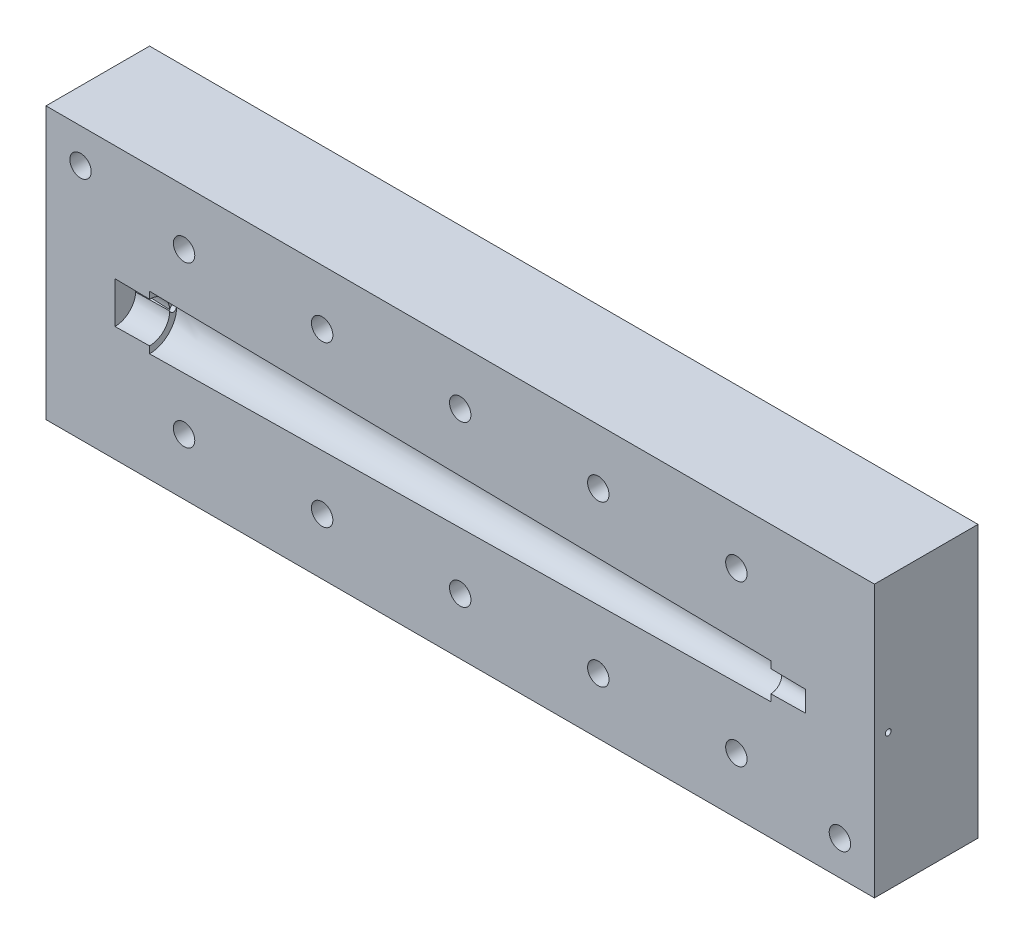
from build123d import *

# Parameters (mm, degrees)
SKIZZE2_W                        = 120
SKIZZE2_H                        = 39.364160046
AUFSATZ_LINEAR_AUSTRAGEN1_DEPTH  = 30
SKIZZE24_R                       = 1.55
SCHNITT_LINEAR_AUSTRAGEN4_DEPTH  = 130.805766806
SKIZZE46_R                       = 2.85
SCHNITT_LINEAR_AUSTRAGEN15_DEPTH = 10
SCHNITT_LINEAR_START             = -5
SCHNITT_LINEAR_AUSTRAGEN25_DEPTH = 2.7
LINEARES_MUSTER1_COUNT           = 5
LINEARES_MUSTER1_PITCH           = 20
SPIEGELN2_COPY_1_SKETCH_R        = 2.85
SPIEGELN2_COPY_1_DEPTH           = 10
SPIEGELN2_COPY_2_SKETCH_R        = 2.85
SPIEGELN2_COPY_2_DEPTH           = 10
SPIEGELN2_COPY_3_SKETCH_R        = 2.85
SPIEGELN2_COPY_3_DEPTH           = 10
SPIEGELN2_COPY_4_SKETCH_R        = 2.85
SPIEGELN2_COPY_4_DEPTH           = 10
SPIEGELN2_START                  = -5
SPIEGELN2_COPY_5_DEPTH           = 2.7
SPIEGELN2_COPY_6_DEPTH           = 2.7
SPIEGELN2_COPY_7_DEPTH           = 2.7
SPIEGELN2_COPY_8_DEPTH           = 2.7
SKIZZE51_R                       = 1.55
SCHNITT_LINEAR_AUSTRAGEN26_DEPTH = 130.805766806
SKIZZE67_R                       = 0.425
SCHNITT_LINEAR_AUSTRAGEN30_DEPTH = 20
SKIZZE70_R                       = 0.5
SCHNITT_LINEAR_AUSTRAGEN37_DEPTH = 16
SKIZZE71_R                       = 2
SCHNITT_LINEAR_AUSTRAGEN38_DEPTH = 6
ABSPALTEN3_START                 = 15
ABSPALTEN3_OUTLINE_W             = 120
ABSPALTEN3_OUTLINE_H             = 39.364160046
ABSPALTEN3_OUTLINE_R             = 1.55
ABSPALTEN3_DEPTH                 = 15


# Read off the part's stored shape, not the designer's step: Abspalten3
with BuildPart() as part:
    # Skizze2 → Aufsatz-Linear austragen1 (new body)
    with BuildSketch(Plane.XY):
        with Locations((60, 19.682080023)):
            Rectangle(SKIZZE2_W, SKIZZE2_H)
    extrude(amount=AUFSATZ_LINEAR_AUSTRAGEN1_DEPTH)

    # Skizze24 → Schnitt-Linear austragen4 (cut, through all)
    with BuildSketch(Plane.XY.offset(30)):
        with Locations((20, 31.364160046)):
            Circle(SKIZZE24_R)
        with Locations((40, 31.364160046)):
            Circle(SKIZZE24_R)
        with Locations((60, 31.364160046)):
            Circle(SKIZZE24_R)
        with Locations((80, 31.364160046)):
            Circle(SKIZZE24_R)
        with Locations((100, 31.364160046)):
            Circle(SKIZZE24_R)
    schnitt_linear_austragen4 = extrude(amount=-SCHNITT_LINEAR_AUSTRAGEN4_DEPTH, mode=Mode.SUBTRACT)

    # Skizze46 → Schnitt-Linear austragen15 (cut)
    with BuildSketch(Plane(origin=(0, 0, 0), x_dir=(-1, 0, 0), z_dir=(0, 0, -1))):
        with Locations((-100, 31.364160046)):
            Circle(SKIZZE46_R)
    schnitt_linear_austragen15 = extrude(amount=-SCHNITT_LINEAR_AUSTRAGEN15_DEPTH, mode=Mode.SUBTRACT)

    # Skizze50 → Schnitt-Linear austragen25 (cut)
    with BuildSketch(Plane.XY.offset(30).offset(SCHNITT_LINEAR_START)):
        Polygon((97.15, 33.009608314), (97.15, 39.364160046), (102.85, 39.364160046), (102.85, 33.009608314), (102.85, 29.718711779), (100, 28.073263512), (97.15, 29.718711779), align=None)
    schnitt_linear_austragen25 = extrude(amount=-SCHNITT_LINEAR_AUSTRAGEN25_DEPTH, mode=Mode.SUBTRACT)

    # Lineares Muster1: Schnitt-Linear austragen15, Schnitt-Linear austragen25 ×5
    with Locations(*[(-i * LINEARES_MUSTER1_PITCH, 0, 0) for i in range(1, LINEARES_MUSTER1_COUNT)]):
        add(schnitt_linear_austragen15, mode=Mode.SUBTRACT)
        add(schnitt_linear_austragen25, mode=Mode.SUBTRACT)

    # Spiegeln2: Schnitt-Linear austragen15, Schnitt-Linear austragen25 across plane
    add(schnitt_linear_austragen15.mirror(Plane.ZX.offset(19.764160046)), mode=Mode.SUBTRACT)
    add(schnitt_linear_austragen25.mirror(Plane.ZX.offset(19.764160046)), mode=Mode.SUBTRACT)

    # Spiegeln2 copy 1 sketch → Spiegeln2 copy 1 (cut)
    with BuildSketch(Plane(origin=(-20, 39.528320093, 0), x_dir=(-1, 0, 0), z_dir=(0, 0, -1))):
        with Locations((-100, -31.364160046)):
            Circle(SPIEGELN2_COPY_1_SKETCH_R)
    extrude(amount=-SPIEGELN2_COPY_1_DEPTH, mode=Mode.SUBTRACT)

    # Spiegeln2 copy 2 sketch → Spiegeln2 copy 2 (cut)
    with BuildSketch(Plane(origin=(-40, 39.528320093, 0), x_dir=(-1, 0, 0), z_dir=(0, 0, -1))):
        with Locations((-100, -31.364160046)):
            Circle(SPIEGELN2_COPY_2_SKETCH_R)
    extrude(amount=-SPIEGELN2_COPY_2_DEPTH, mode=Mode.SUBTRACT)

    # Spiegeln2 copy 3 sketch → Spiegeln2 copy 3 (cut)
    with BuildSketch(Plane(origin=(-60, 39.528320093, 0), x_dir=(-1, 0, 0), z_dir=(0, 0, -1))):
        with Locations((-100, -31.364160046)):
            Circle(SPIEGELN2_COPY_3_SKETCH_R)
    extrude(amount=-SPIEGELN2_COPY_3_DEPTH, mode=Mode.SUBTRACT)

    # Spiegeln2 copy 4 sketch → Spiegeln2 copy 4 (cut)
    with BuildSketch(Plane(origin=(-80, 39.528320093, 0), x_dir=(-1, 0, 0), z_dir=(0, 0, -1))):
        with Locations((-100, -31.364160046)):
            Circle(SPIEGELN2_COPY_4_SKETCH_R)
    extrude(amount=-SPIEGELN2_COPY_4_DEPTH, mode=Mode.SUBTRACT)

    # Spiegeln2 copy 5 sketch → Spiegeln2 copy 5 (cut)
    with BuildSketch(Plane(origin=(-20, 39.528320093, 30), x_dir=(1, 0, 0), z_dir=(0, 0, 1)).offset(SPIEGELN2_START)):
        Polygon((97.15, -33.009608314), (97.15, -39.364160046), (102.85, -39.364160046), (102.85, -33.009608314), (102.85, -29.718711779), (100, -28.073263512), (97.15, -29.718711779), align=None)
    extrude(amount=-SPIEGELN2_COPY_5_DEPTH, mode=Mode.SUBTRACT)

    # Spiegeln2 copy 6 sketch → Spiegeln2 copy 6 (cut)
    with BuildSketch(Plane(origin=(-40, 39.528320093, 30), x_dir=(1, 0, 0), z_dir=(0, 0, 1)).offset(SPIEGELN2_START)):
        Polygon((97.15, -33.009608314), (97.15, -39.364160046), (102.85, -39.364160046), (102.85, -33.009608314), (102.85, -29.718711779), (100, -28.073263512), (97.15, -29.718711779), align=None)
    extrude(amount=-SPIEGELN2_COPY_6_DEPTH, mode=Mode.SUBTRACT)

    # Spiegeln2 copy 7 sketch → Spiegeln2 copy 7 (cut)
    with BuildSketch(Plane(origin=(-60, 39.528320093, 30), x_dir=(1, 0, 0), z_dir=(0, 0, 1)).offset(SPIEGELN2_START)):
        Polygon((97.15, -33.009608314), (97.15, -39.364160046), (102.85, -39.364160046), (102.85, -33.009608314), (102.85, -29.718711779), (100, -28.073263512), (97.15, -29.718711779), align=None)
    extrude(amount=-SPIEGELN2_COPY_7_DEPTH, mode=Mode.SUBTRACT)

    # Spiegeln2 copy 8 sketch → Spiegeln2 copy 8 (cut)
    with BuildSketch(Plane(origin=(-80, 39.528320093, 30), x_dir=(1, 0, 0), z_dir=(0, 0, 1)).offset(SPIEGELN2_START)):
        Polygon((97.15, -33.009608314), (97.15, -39.364160046), (102.85, -39.364160046), (102.85, -33.009608314), (102.85, -29.718711779), (100, -28.073263512), (97.15, -29.718711779), align=None)
    extrude(amount=-SPIEGELN2_COPY_8_DEPTH, mode=Mode.SUBTRACT)

    # Spiegeln3: Schnitt-Linear austragen4 across plane
    add(schnitt_linear_austragen4.mirror(Plane.ZX.offset(19.764160046)), mode=Mode.SUBTRACT)

    # Skizze51 → Schnitt-Linear austragen26 (cut, through all)
    with BuildSketch(Plane.XY.offset(30)):
        with Locations((5, 34.364160046)):
            Circle(SKIZZE51_R)
        with Locations((115, 5)):
            Circle(SKIZZE51_R)
    extrude(amount=-SCHNITT_LINEAR_AUSTRAGEN26_DEPTH, mode=Mode.SUBTRACT)

    # Skizze66 → Schnitt-Rotation5 (revolve, cut)
    with BuildSketch(Plane.XY.offset(15), mode=Mode.PRIVATE) as schnitt_rotation5_sk:
        Polygon((110, 19.682080023), (110, 21.182080023), (10, 22.682080023), (10, 19.682080023), align=None)
        Polygon((105, 19.682080023), (105, 22.257192517), (15, 23.607192517), (15, 19.682080023), align=None)
    revolve(schnitt_rotation5_sk.sketch.rotate(Axis((10, 19.682080023, 15), (1, 0, 0)), 180), axis=Axis((10, 19.682080023, 15), (1, 0, 0)), mode=Mode.SUBTRACT)

    # Skizze67 → Schnitt-Linear austragen30 (cut)
    with BuildSketch(Plane(origin=(120, 0, 0), x_dir=(0, 0, -1), z_dir=(1, 0, 0))):
        with Locations((-17, 19.764160046)):
            Circle(SKIZZE67_R)
    schnitt_linear_austragen30 = extrude(amount=-SCHNITT_LINEAR_AUSTRAGEN30_DEPTH, mode=Mode.SUBTRACT)

    # Spiegeln7: Schnitt-Linear austragen30 across plane
    add(schnitt_linear_austragen30.mirror(Plane.XY.offset(15)), mode=Mode.SUBTRACT)

    # Skizze70 → Schnitt-Linear austragen37 (cut)
    with BuildSketch(Plane.ZY):
        with Locations((11.58373564, 19.764160046)):
            Circle(SKIZZE70_R)
    extrude(amount=-SCHNITT_LINEAR_AUSTRAGEN37_DEPTH, mode=Mode.SUBTRACT)

    # Skizze71 → Schnitt-Linear austragen38 (cut)
    with BuildSketch(Plane.ZY):
        with Locations((11.58373564, 19.764160046)):
            Circle(SKIZZE71_R)
    extrude(amount=-SCHNITT_LINEAR_AUSTRAGEN38_DEPTH, mode=Mode.SUBTRACT)

    # Abspalten3 outline → Abspalten3 (cut)
    with BuildSketch(Plane.XY.offset(ABSPALTEN3_START)):
        with Locations((60, 19.682080023)):
            Rectangle(ABSPALTEN3_OUTLINE_W, ABSPALTEN3_OUTLINE_H)
        with Locations((115, 5)):
            Circle(ABSPALTEN3_OUTLINE_R, mode=Mode.SUBTRACT)
        with Locations((5, 34.364160046)):
            Circle(ABSPALTEN3_OUTLINE_R, mode=Mode.SUBTRACT)
        with Locations((20, 31.364160046)):
            Circle(ABSPALTEN3_OUTLINE_R, mode=Mode.SUBTRACT)
        with Locations((40, 31.364160046)):
            Circle(ABSPALTEN3_OUTLINE_R, mode=Mode.SUBTRACT)
        with Locations((60, 31.364160046)):
            Circle(ABSPALTEN3_OUTLINE_R, mode=Mode.SUBTRACT)
        with Locations((80, 31.364160046)):
            Circle(ABSPALTEN3_OUTLINE_R, mode=Mode.SUBTRACT)
        with Locations((100, 31.364160046)):
            Circle(ABSPALTEN3_OUTLINE_R, mode=Mode.SUBTRACT)
        with Locations((20, 8.164160046)):
            Circle(ABSPALTEN3_OUTLINE_R, mode=Mode.SUBTRACT)
        with Locations((40, 8.164160046)):
            Circle(ABSPALTEN3_OUTLINE_R, mode=Mode.SUBTRACT)
        with Locations((60, 8.164160046)):
            Circle(ABSPALTEN3_OUTLINE_R, mode=Mode.SUBTRACT)
        with Locations((80, 8.164160046)):
            Circle(ABSPALTEN3_OUTLINE_R, mode=Mode.SUBTRACT)
        with Locations((100, 8.164160046)):
            Circle(ABSPALTEN3_OUTLINE_R, mode=Mode.SUBTRACT)
    extrude(amount=ABSPALTEN3_DEPTH, mode=Mode.SUBTRACT)


solid = part.part
